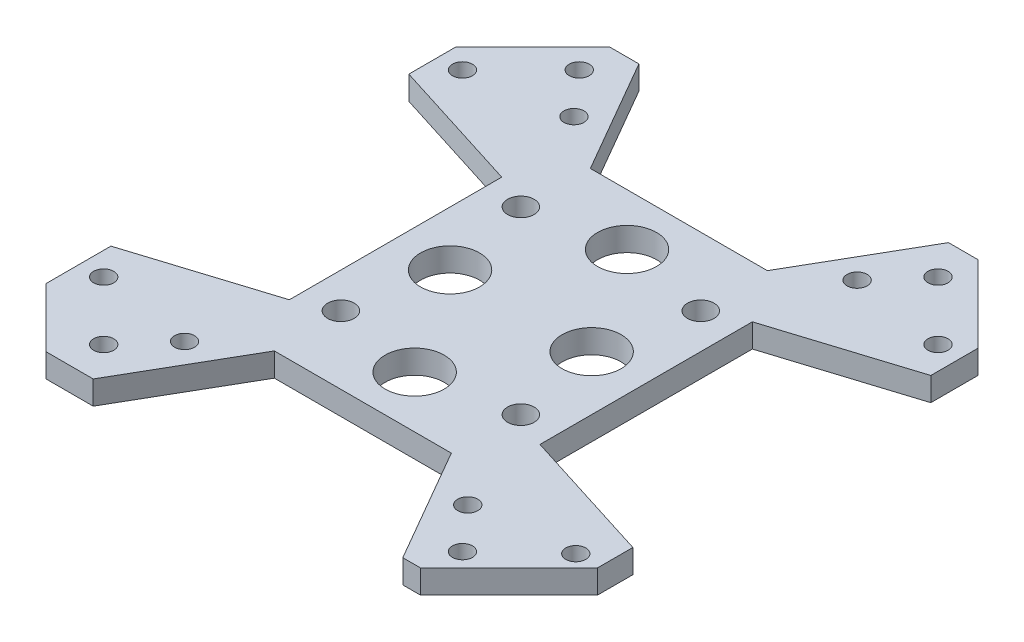
from build123d import *

# Parameters (mm, degrees)
SKETCH_1_R      = 2.25
SKETCH_1_R_2    = 1.7
SKETCH_1_R_3    = 5
SKETCH_1_R_4    = 1.69491354
EXTRUDE_1_DEPTH = 4


with BuildPart() as part:
    # 草图1 → 凸台-拉伸1 (new body)
    with BuildSketch(Plane(origin=(0, 0, 0), x_dir=(1, 0, 0), z_dir=(0, 1, 0))):
        Polygon((44.23849367, 33.250010702), (44.23849367, 25.250010702), (21.23849367, 18), (21.23849367, -18), (44.23849367, -25.250010702), (44.23849367, -31.250010702), (29.23849367, -46.250010702), (26.23849367, -46.250010702), (15, -26.784368666), (-15, -26.784368666), (-26.23849367, -46.250010702), (-34.23849367, -46.250010702), (-44.23849367, -36.250010702), (-44.23849367, -25.250010702), (-21.23849367, -18), (-21.23849367, 18), (-44.23849367, 25.250010702), (-44.23849367, 33.250010702), (-31.23849367, 46.250010702), (-26.23849367, 46.250010702), (-15, 26.784368666), (15, 26.784368666), (26.23849367, 46.250010702), (31.23849367, 46.250010702), align=None)
        with Locations((-15.25, -15.25)):
            Circle(SKETCH_1_R, mode=Mode.SUBTRACT)
        with Locations((-15.25, 15.25)):
            Circle(SKETCH_1_R, mode=Mode.SUBTRACT)
        with Locations((15.25, -15.25)):
            Circle(SKETCH_1_R, mode=Mode.SUBTRACT)
        with Locations((15.25, 15.25)):
            Circle(SKETCH_1_R, mode=Mode.SUBTRACT)
        with Locations((-24, -33)):
            Circle(SKETCH_1_R_2, mode=Mode.SUBTRACT)
        with Locations((-12, 0)):
            Circle(SKETCH_1_R_3, mode=Mode.SUBTRACT)
        with Locations((0, 18)):
            Circle(SKETCH_1_R_3, mode=Mode.SUBTRACT)
        with Locations((-30.40559154, -40.30508646)):
            Circle(SKETCH_1_R_2, mode=Mode.SUBTRACT)
        with Locations((-30.40559154, 40.30508646)):
            Circle(SKETCH_1_R_2, mode=Mode.SUBTRACT)
        with Locations((-40.30508646, 30.40559154)):
            Circle(SKETCH_1_R_2, mode=Mode.SUBTRACT)
        with Locations((30.40559154, -40.30508646)):
            Circle(SKETCH_1_R_2, mode=Mode.SUBTRACT)
        with Locations((40.30508646, -31)):
            Circle(SKETCH_1_R_4, mode=Mode.SUBTRACT)
        with Locations((40.30508646, 30.40559154)):
            Circle(SKETCH_1_R_4, mode=Mode.SUBTRACT)
        with Locations((30.40559154, 40.30508646)):
            Circle(SKETCH_1_R_2, mode=Mode.SUBTRACT)
        with Locations((-40.30508646, -30.40559154)):
            Circle(SKETCH_1_R_2, mode=Mode.SUBTRACT)
        with Locations((24, -33)):
            Circle(SKETCH_1_R_2, mode=Mode.SUBTRACT)
        with Locations((24, 33)):
            Circle(SKETCH_1_R_2, mode=Mode.SUBTRACT)
        with Locations((-24, 33)):
            Circle(SKETCH_1_R_2, mode=Mode.SUBTRACT)
        with Locations((12, 0)):
            Circle(SKETCH_1_R_3, mode=Mode.SUBTRACT)
        with Locations((0, -18)):
            Circle(SKETCH_1_R_3, mode=Mode.SUBTRACT)
    extrude(amount=EXTRUDE_1_DEPTH)


solid = part.part
